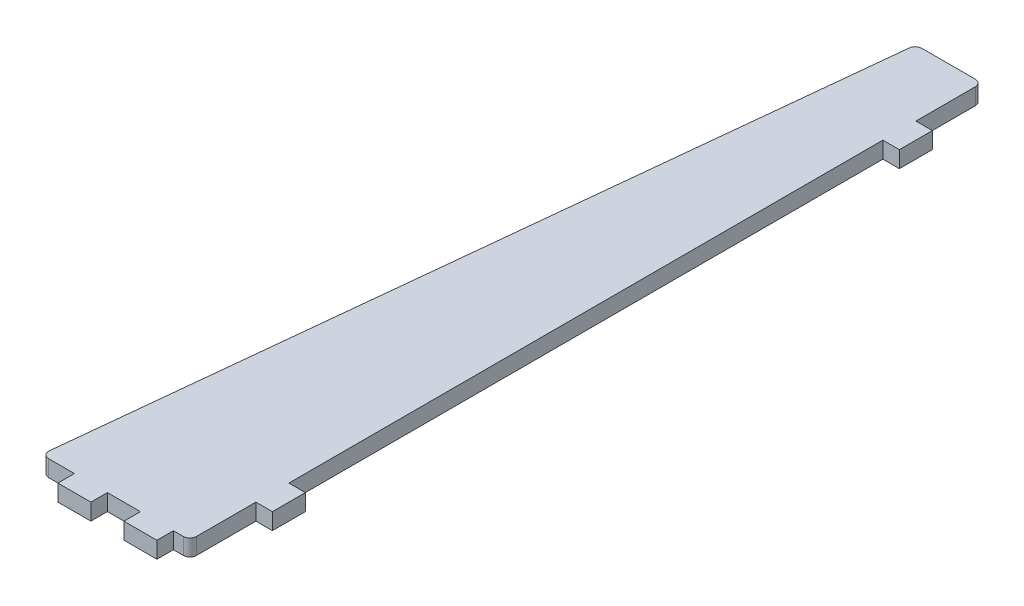
from build123d import *

# Parameters (mm, degrees)
SIDE_PLATE_DEPTH = 6.35
FILLET1_R        = 2.54


with BuildPart() as part:
    # Sketch1 → Side Plate (new body)
    with BuildSketch(Plane(origin=(0, 0, 0), x_dir=(1, 0, 0), z_dir=(0, 1, 0))):
        Polygon((0, 0), (12.7, 0), (12.7, -6.35), (25.4, -6.35), (25.4, 0), (38.1, 0), (38.1, -6.35), (50.8, -6.35), (50.8, 0), (57.15, 0), (57.15, 25.4), (63.5, 25.4), (63.5, 38.1), (57.15, 38.1), (57.15, 266.7), (63.5, 266.7), (63.5, 279.4), (57.15, 279.4), (57.15, 304.8), (31.75, 304.8), align=None)
    extrude(amount=SIDE_PLATE_DEPTH)

    # Fillet1
    fillet1_edges = [part.edges().sort_by_distance(p)[0] for p in [
        (57.15, 3.175, 0),
        (57.15, 3.175, -304.8),
        (31.75, 3.175, -304.8),
        (0, 3.175, 0),
    ]]
    fillet(fillet1_edges, radius=FILLET1_R)


solid = part.part
